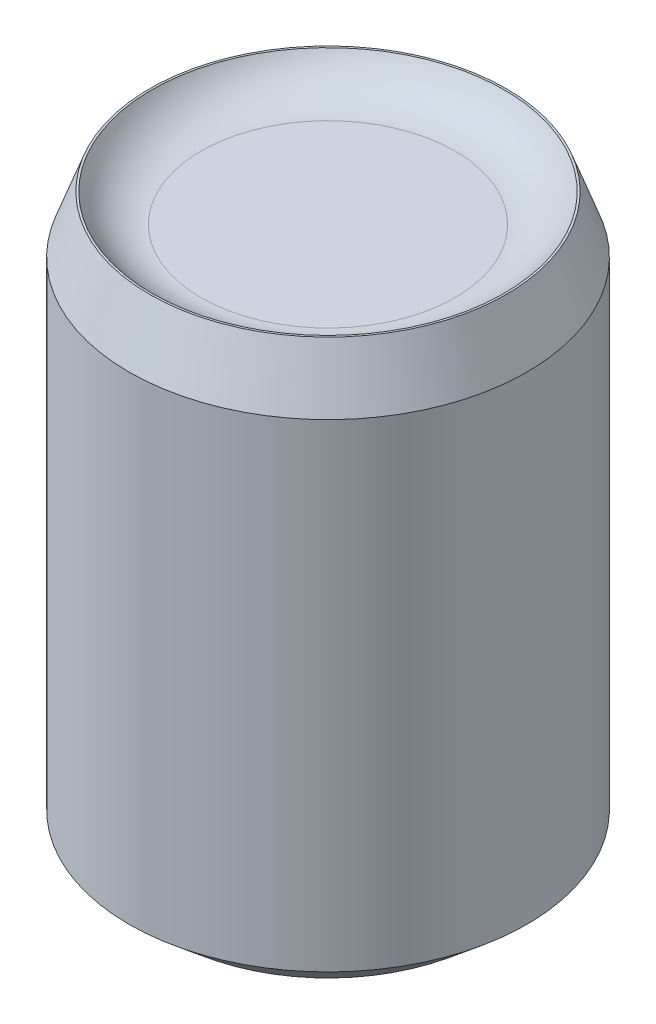
from build123d import *

# Parameters (mm, degrees)
SKETCH1_R           = 35
BOSS_EXTRUDE1_DEPTH = 100
CHAMFER1_SIZE       = 10
CHAMFER1_SIZE2      = 3.639702343
CHAMFER2_SIZE       = 7
CHAMFER2_SIZE2      = 5.873697418
SKETCH2_R           = 31
CUT_EXTRUDE1_DEPTH  = 5
FILLET1_R           = 10


with BuildPart() as part:
    # Sketch1 → Boss-Extrude1 (new body)
    with BuildSketch(Plane(origin=(0, 0, 0), x_dir=(1, 0, 0), z_dir=(0, 1, 0))):
        with Locations(Location((0, 0, 0), (0, 0, 270))):
            Circle(SKETCH1_R)
    extrude(amount=BOSS_EXTRUDE1_DEPTH)

    # Chamfer1
    chamfer1_edges = [part.edges().sort_by_distance(p)[0] for p in [
        (0, 100, -35),
    ]]
    chamfer1_side = [part.faces().sort_by_distance(p)[0] for p in [
        (0, 50, -35),
    ]]
    chamfer(chamfer1_edges, length=CHAMFER1_SIZE, length2=CHAMFER1_SIZE2, reference=chamfer1_side[0])

    # Chamfer2
    chamfer2_edges = [part.edges().sort_by_distance(p)[0] for p in [
        (0, 0, -35),
    ]]
    chamfer2_side = [part.faces().sort_by_distance(p)[0] for p in [
        (0, 0, 0),
    ]]
    chamfer(chamfer2_edges, length=CHAMFER2_SIZE, length2=CHAMFER2_SIZE2, reference=chamfer2_side[0])

    # Sketch2 → Cut-Extrude1 (cut)
    with BuildSketch(Plane(origin=(0, 100, 0), x_dir=(1, 0, 0), z_dir=(0, 1, 0))):
        with Locations(Location((0, 0, 0), (0, 0, 270))):
            Circle(SKETCH2_R)
    extrude(amount=-CUT_EXTRUDE1_DEPTH, mode=Mode.SUBTRACT)

    # Fillet1
    # the kernel refuses this fillet: 10 mm, written as the material it adds along each edge
    with BuildSketch(Plane(origin=(0, 95, 0), x_dir=(0, 0, 1), z_dir=(-1, 0, 0))) as fillet1_piece_1:
        with BuildLine():
            CenterArc((22.339745962, 10), FILLET1_R, 270, 60)
            Line((22.339745962, 0), (22.339745962, -0.2))
            Line((22.339745962, -0.2), (31, -0.2))
            Line((31, -0.2), (31.2, 0))
            ThreePointArc((31.2, 0), (31.2, 2.5), (31.173205081, 4.9))
            Line((31.173205081, 4.9), (31, 5))
        make_face()
    revolve(axis=Axis((0, 95, 0), (0, 1, 0)))


solid = part.part
